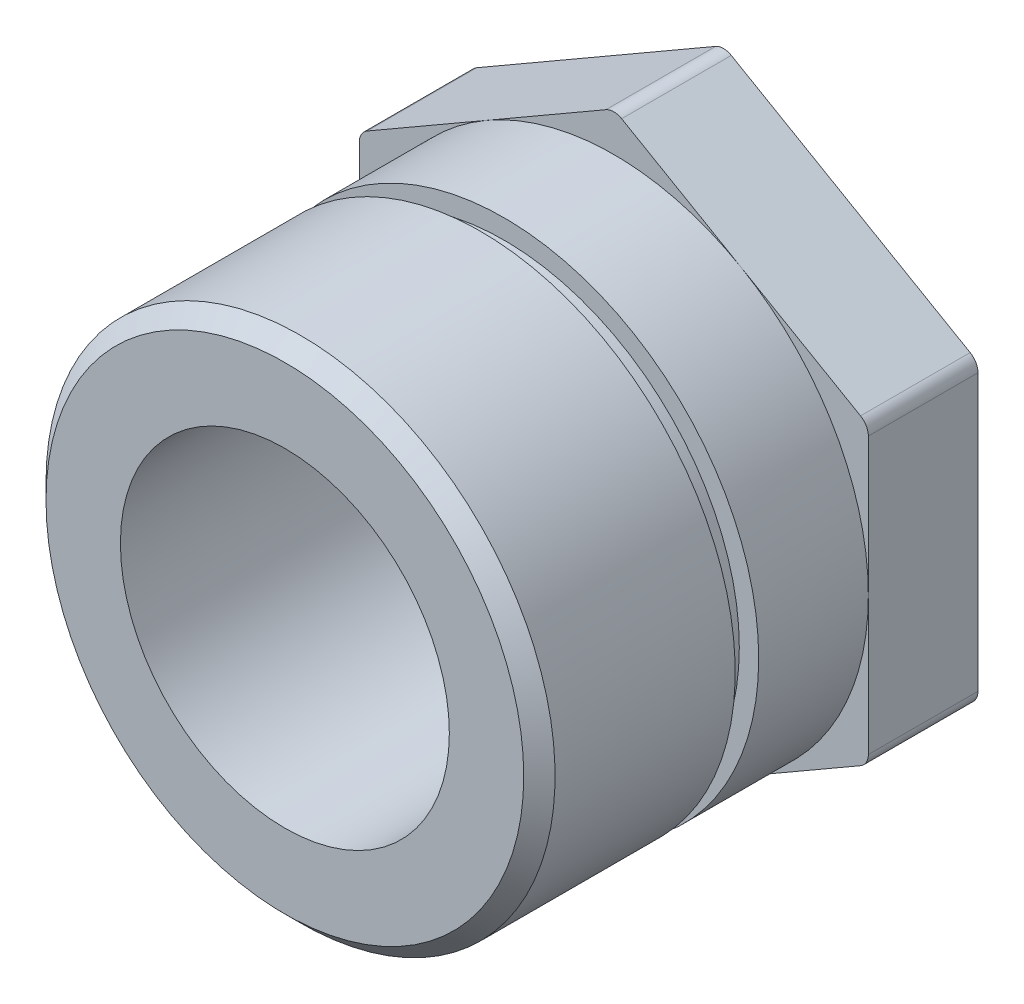
from build123d import *

# Parameters (mm, degrees)
SKETCH1_R           = 32.5
BOSS_EXTRUDE1_DEPTH = 42
BOSS_EXTRUDE5_START = -28
SKETCH2_R           = 32.5
SKETCH2_R_2         = 30
BOSS_EXTRUDE5_DEPTH = 3
CUT_EXTRUDE1_START  = -28
SKETCH6_R           = 32.5
SKETCH6_R_2         = 30.024115047
CUT_EXTRUDE1_DEPTH  = 3
BOSS_EXTRUDE6_DEPTH = 14
FILLET1_R           = 2
CHAMFER1_SIZE       = 2
SKETCH8_R           = 21
CUT_EXTRUDE2_DEPTH  = 75.682372746


with BuildPart() as part:
    # Sketch1 → Boss-Extrude1 (new body)
    with BuildSketch(Plane.XY):
        Circle(SKETCH1_R)
    extrude(amount=BOSS_EXTRUDE1_DEPTH)

    # Sketch2 → Boss-Extrude5 (add)
    with BuildSketch(Plane.XY.offset(42).offset(BOSS_EXTRUDE5_START)):
        Circle(SKETCH2_R)
        Circle(SKETCH2_R_2, mode=Mode.SUBTRACT)
    extrude(amount=BOSS_EXTRUDE5_DEPTH)

    # Sketch6 → Cut-Extrude1 (cut)
    with BuildSketch(Plane.XY.offset(42).offset(CUT_EXTRUDE1_START)):
        Circle(SKETCH6_R)
        Circle(SKETCH6_R_2, mode=Mode.SUBTRACT)
    extrude(amount=CUT_EXTRUDE1_DEPTH, mode=Mode.SUBTRACT)

    # Sketch7 → Boss-Extrude6 (add)
    with BuildSketch(Plane(origin=(0, 0, 0), x_dir=(-1, 0, 0), z_dir=(0, 0, -1))):
        Polygon((0, 37.527767497), (-32.5, 18.763883749), (-32.5, -18.763883749), (0, -37.527767497), (32.5, -18.763883749), (32.5, 18.763883749), align=None)
    extrude(amount=BOSS_EXTRUDE6_DEPTH)

    # Fillet1
    fillet1_edges = [part.edges().sort_by_distance(p)[0] for p in [
        (-32.5, 18.763883749, -7),
        (0, -37.527767497, -7),
        (32.5, -18.763883749, -7),
        (32.5, 18.763883749, -7),
        (0, 37.527767497, -7),
        (-32.5, -18.763883749, -7),
    ]]
    fillet(fillet1_edges, radius=FILLET1_R)

    # Chamfer1
    chamfer1_edges = [part.edges().sort_by_distance(p)[0] for p in [
        (-32.5, 0, 42),
    ]]
    chamfer(chamfer1_edges, length=CHAMFER1_SIZE)

    # Sketch8 → Cut-Extrude2 (cut, through all)
    with BuildSketch(Plane.XY.offset(42)):
        Circle(SKETCH8_R)
    extrude(amount=-CUT_EXTRUDE2_DEPTH, mode=Mode.SUBTRACT)


solid = part.part
